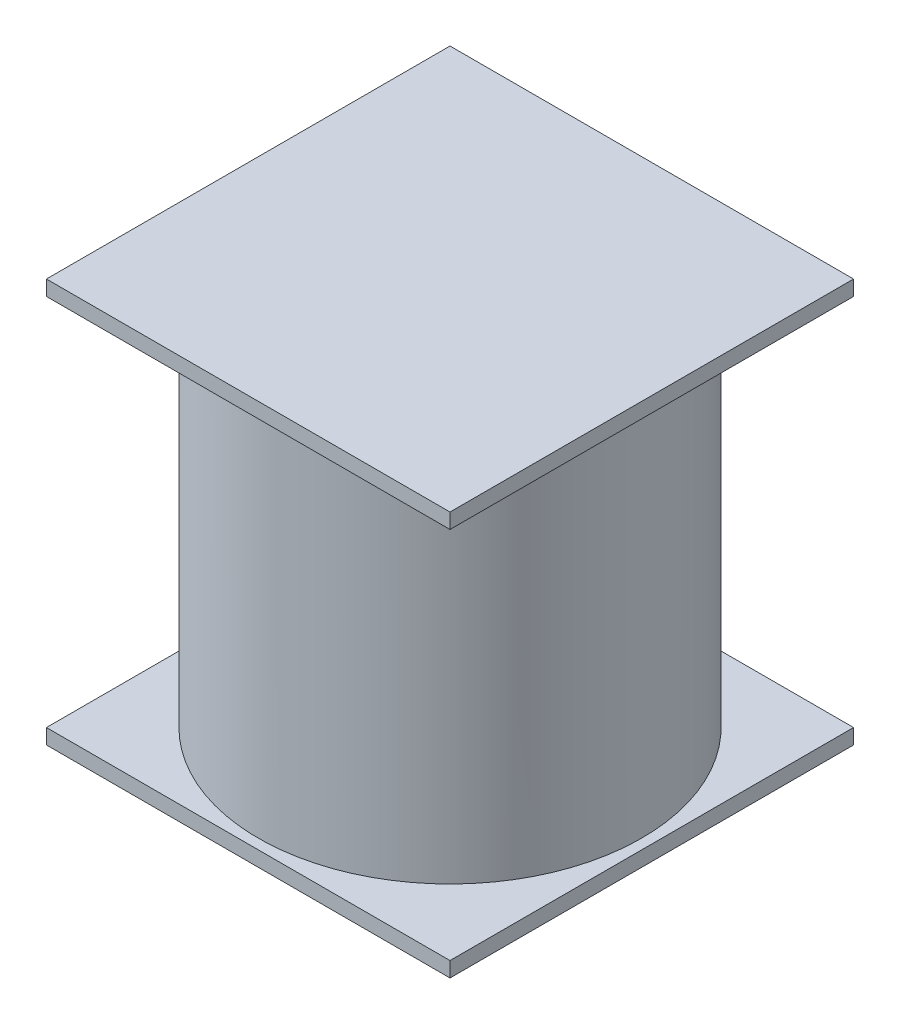
from build123d import *

# Parameters (mm, degrees)
SKETCH1_W           = 80
SKETCH1_H           = 80
BOSS_EXTRUDE1_DEPTH = 3
SKETCH3_R           = 38
SKETCH3_R_2         = 35
EXTRUDE_THIN1_DEPTH = 74
SKETCH5_W           = 80
SKETCH5_H           = 80
BOSS_EXTRUDE2_DEPTH = 3


with BuildPart() as part:
    # Sketch1 → Boss-Extrude1 (new body)
    with BuildSketch(Plane(origin=(0, 0, 0), x_dir=(1, 0, 0), z_dir=(0, 1, 0))):
        with Locations((40, 40)):
            Rectangle(SKETCH1_W, SKETCH1_H)
    extrude(amount=BOSS_EXTRUDE1_DEPTH)

    # Sketch3 → Extrude-Thin1 (add)
    with BuildSketch(Plane(origin=(0, 3, 0), x_dir=(1, 0, 0), z_dir=(0, 1, 0))):
        with Locations((40, 40)):
            Circle(SKETCH3_R)
        with Locations((40, 40)):
            Circle(SKETCH3_R_2, mode=Mode.SUBTRACT)
    extrude(amount=EXTRUDE_THIN1_DEPTH)

    # Sketch5 → Boss-Extrude2 (add)
    with BuildSketch(Plane(origin=(0, 77, 0), x_dir=(1, 0, 0), z_dir=(0, 1, 0))):
        with Locations((40, 40)):
            Rectangle(SKETCH5_W, SKETCH5_H)
    extrude(amount=BOSS_EXTRUDE2_DEPTH)


solid = part.part
